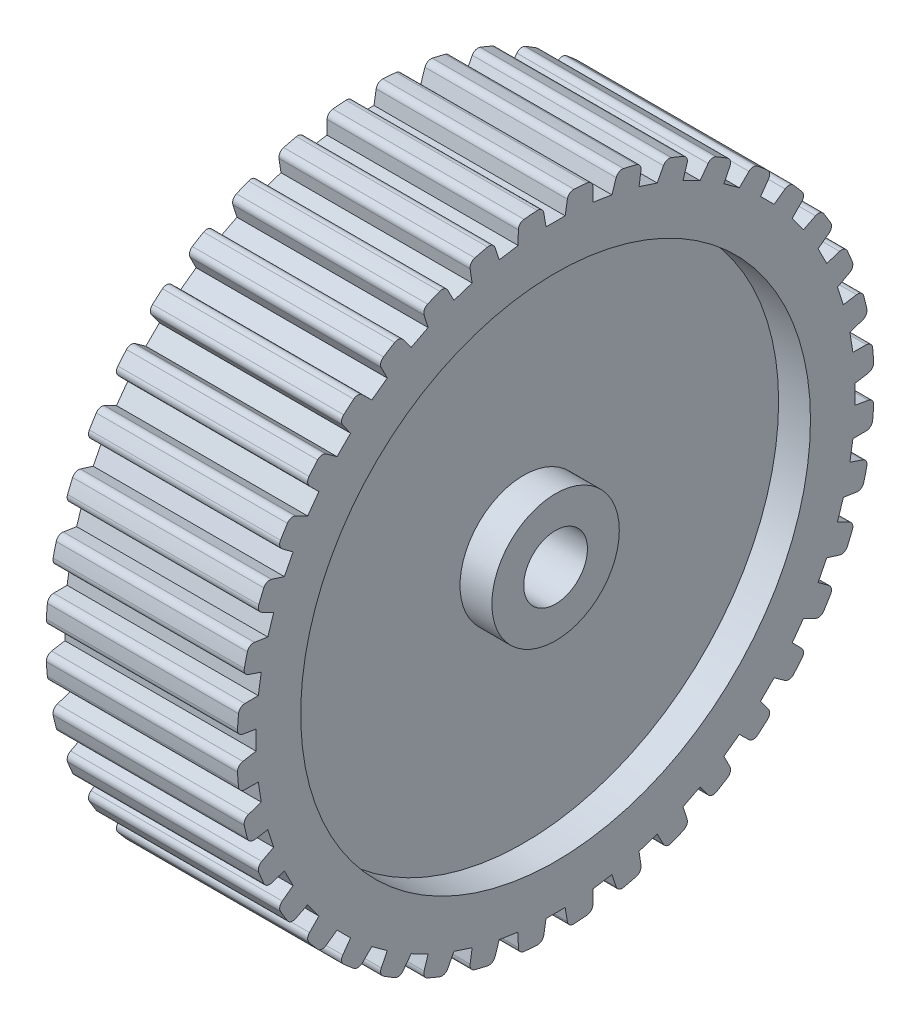
from build123d import *

# Parameters (mm, degrees)
CUT_EXTRUDE1_DEPTH       = 44
FILLET1_R                = 1
CIRPATTERN1_COUNT        = 40
FILLET1_OF_CIRPATTERN1_R = 1


with BuildPart() as part:
    # Sketch1 → Revolve1 (revolve)
    with BuildSketch(Plane.XY):
        Polygon((0, 5), (-30, 5), (-30, 10), (-25, 10), (-25, 40), (-30, 40), (-30, 50), (0, 50), (0, 40), (-5, 40), (-5, 10), (0, 10), align=None)
    revolve(axis=Axis((0, 0, 0), (-1, 0, 0)))

    # Sketch2 → Cut-Extrude1 (cut)
    with BuildSketch(Plane(origin=(0, 0, 0), x_dir=(0, 0, -1), z_dir=(1, 0, 0))):
        Polygon((-2.5, 53), (-1.5, 47), (1.5, 47), (2.5, 53), align=None)
    cut_extrude1 = extrude(amount=-CUT_EXTRUDE1_DEPTH, mode=Mode.SUBTRACT)

    # Fillet1
    fillet1_edges = [part.edges().sort_by_distance(p)[0] for p in [
        (-15, 49.960248768, 1.993374795),
        (-15, 49.960248768, -1.993374795),
    ]]
    fillet(fillet1_edges, radius=FILLET1_R)

    # CirPattern1: Cut-Extrude1 ×40 about axis
    cirpattern1_axis = Axis((0, 0, 0), (1, 0, 0))
    for i in range(1, CIRPATTERN1_COUNT):
        add(cut_extrude1.rotate(cirpattern1_axis, i * 360 / CIRPATTERN1_COUNT), mode=Mode.SUBTRACT)

    # Fillet1 of CirPattern1
    fillet1_of_cirpattern1_edges = [part.edges().sort_by_distance(p)[0] for p in [
        (-15, 49.033322681, 9.784337832),
        (-15, 49.656987721, 5.846671746),
        (-15, 46.899033459, 17.334378),
        (-15, 48.131006834, 13.542753825),
        (-15, 43.609934383, 24.457588252),
        (-15, 45.419880821, 20.905368358),
        (-15, 39.24701399, 30.978571512),
        (-15, 41.590366603, 27.753223342),
        (-15, 33.917701859, 36.736759528),
        (-15, 36.736759528, 33.917701859),
        (-15, 27.753223342, 41.590366603),
        (-15, 30.978571512, 39.24701399),
        (-15, 20.905368358, 45.419880821),
        (-15, 24.457588252, 43.609934383),
        (-15, 13.542753825, 48.131006834),
        (-15, 17.334378, 46.899033459),
        (-15, 5.846671746, 49.656987721),
        (-15, 9.784337832, 49.033322681),
        (-15, -1.993374795, 49.960248768),
        (-15, 1.993374795, 49.960248768),
        (-15, -9.784337832, 49.033322681),
        (-15, -5.846671746, 49.656987721),
        (-15, -17.334378, 46.899033459),
        (-15, -13.542753825, 48.131006834),
        (-15, -24.457588252, 43.609934383),
        (-15, -20.905368358, 45.419880821),
        (-15, -30.978571512, 39.24701399),
        (-15, -27.753223342, 41.590366603),
        (-15, -36.736759528, 33.917701859),
        (-15, -33.917701859, 36.736759528),
        (-15, -41.590366603, 27.753223342),
        (-15, -39.24701399, 30.978571512),
        (-15, -45.419880821, 20.905368358),
        (-15, -43.609934383, 24.457588252),
        (-15, -48.131006834, 13.542753825),
        (-15, -46.899033459, 17.334378),
        (-15, -49.656987721, 5.846671746),
        (-15, -49.033322681, 9.784337832),
        (-15, -49.960248768, -1.993374795),
        (-15, -49.960248768, 1.993374795),
        (-15, -49.033322681, -9.784337832),
        (-15, -49.656987721, -5.846671746),
        (-15, -46.899033459, -17.334378),
        (-15, -48.131006834, -13.542753825),
        (-15, -43.609934383, -24.457588252),
        (-15, -45.419880821, -20.905368358),
        (-15, -39.24701399, -30.978571512),
        (-15, -41.590366603, -27.753223342),
        (-15, -33.917701859, -36.736759528),
        (-15, -36.736759528, -33.917701859),
        (-15, -27.753223342, -41.590366603),
        (-15, -30.978571512, -39.24701399),
        (-15, -20.905368358, -45.419880821),
        (-15, -24.457588252, -43.609934383),
        (-15, -13.542753825, -48.131006834),
        (-15, -17.334378, -46.899033459),
        (-15, -5.846671746, -49.656987721),
        (-15, -9.784337832, -49.033322681),
        (-15, 1.993374795, -49.960248768),
        (-15, -1.993374795, -49.960248768),
        (-15, 9.784337832, -49.033322681),
        (-15, 5.846671746, -49.656987721),
        (-15, 17.334378, -46.899033459),
        (-15, 13.542753825, -48.131006834),
        (-15, 24.457588252, -43.609934383),
        (-15, 20.905368358, -45.419880821),
        (-15, 30.978571512, -39.24701399),
        (-15, 27.753223342, -41.590366603),
        (-15, 36.736759528, -33.917701859),
        (-15, 33.917701859, -36.736759528),
        (-15, 41.590366603, -27.753223342),
        (-15, 39.24701399, -30.978571512),
        (-15, 45.419880821, -20.905368358),
        (-15, 43.609934383, -24.457588252),
        (-15, 48.131006834, -13.542753825),
        (-15, 46.899033459, -17.334378),
        (-15, 49.656987721, -5.846671746),
        (-15, 49.033322681, -9.784337832),
    ]]
    fillet(fillet1_of_cirpattern1_edges, radius=FILLET1_OF_CIRPATTERN1_R)


solid = part.part
